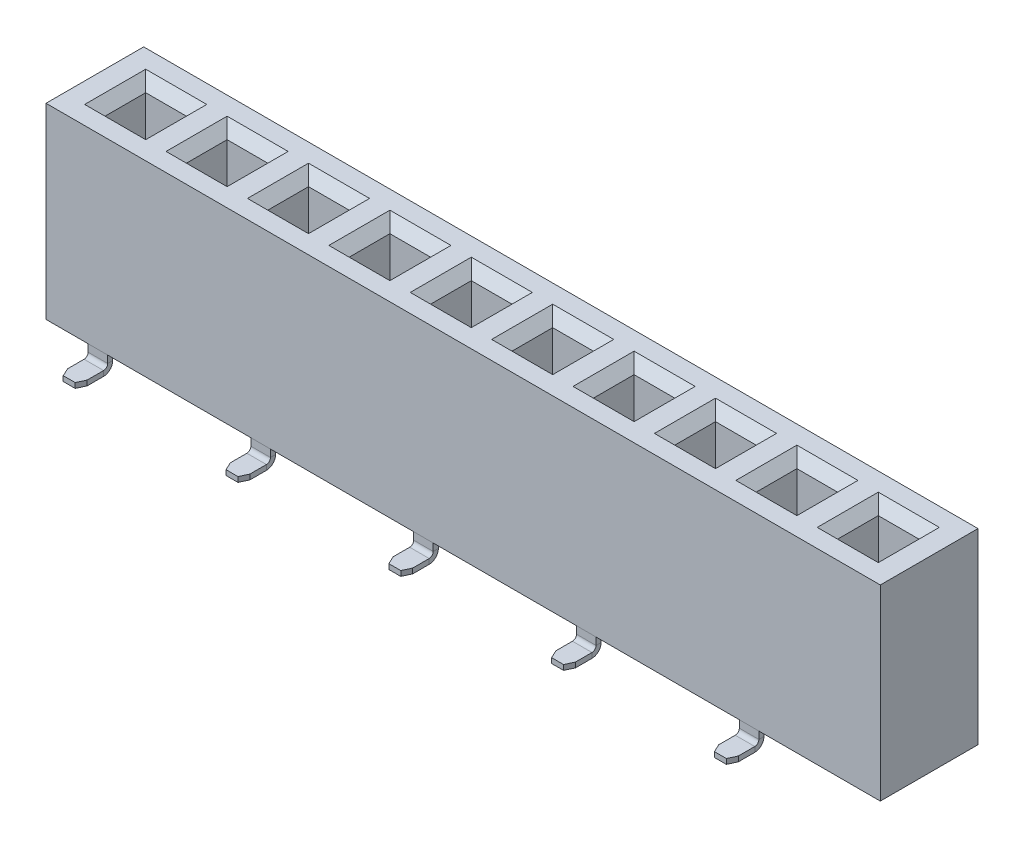
from build123d import *
from OCP.BRepFilletAPI import BRepFilletAPI_MakeChamfer

# Parameters (mm, degrees)
SKETCH1_W                  = 20.5
SKETCH1_H                  = 4.6
BOSS_EXTRUDE1_DEPTH        = 2.4
SKETCH2_W                  = 1
SKETCH2_H                  = 1
CUT_EXTRUDE1_DEPTH         = 2.5
CHAMFER1_SIZE              = 0.25
LPATTERN6_COUNT            = 10
LPATTERN6_PITCH            = 2
CHAMFER1_OF_LPATTERN6_SIZE = 0.25
BASE_FLANGE2_DEPTH         = 0.24
BASE_FLANGE2_DEPTH_BACK    = 0.24
BASE_FLANGE3_DEPTH         = 0.24
BASE_FLANGE3_DEPTH_BACK    = 0.24
CHAMFER3_SIZE              = 0.2
CHAMFER3_SIZE2             = 0.093261532
CHAMFER4_SIZE              = 0.2
CHAMFER4_SIZE2             = 0.093261532
LPATTERN4_COUNT            = 5
LPATTERN4_PITCH            = 4
LPATTERN3_COUNT            = 5
LPATTERN3_PITCH            = 4


# Sheet-metal steps are written as plain solids
with BuildPart() as part:
    # Sketch1 → Boss-Extrude1 (new body)
    with BuildSketch(Plane.XY):
        Rectangle(SKETCH1_W, SKETCH1_H)
    extrude(amount=BOSS_EXTRUDE1_DEPTH)

    # Sketch2 → Cut-Extrude1 (cut)
    with BuildSketch(Plane(origin=(0, 2.3, 0), x_dir=(1, 0, 0), z_dir=(0, 1, 0))):
        with Locations((-9, -1.2)):
            Rectangle(SKETCH2_W, SKETCH2_H)
    cut_extrude1 = extrude(amount=-CUT_EXTRUDE1_DEPTH, mode=Mode.SUBTRACT)

    # Chamfer1
    chamfer1_edges = [part.edges().sort_by_distance(p)[0] for p in [
        (-8.5, 2.3, 1.2),
        (-9, 2.3, 0.7),
        (-9.5, 2.3, 1.2),
        (-9, 2.3, 1.7),
    ]]
    chamfer(chamfer1_edges, length=CHAMFER1_SIZE)

    # LPattern6: Cut-Extrude1 ×10
    with Locations(*[(i * LPATTERN6_PITCH, 0, 0) for i in range(1, LPATTERN6_COUNT)]):
        add(cut_extrude1, mode=Mode.SUBTRACT)

    # Chamfer1 of LPattern6
    chamfer1_of_lpattern6_edges = [part.edges().sort_by_distance(p)[0] for p in [
        (-6.5, 2.3, 1.2),
        (-7, 2.3, 0.7),
        (-7.5, 2.3, 1.2),
        (-7, 2.3, 1.7),
        (-4.5, 2.3, 1.2),
        (-5, 2.3, 0.7),
        (-5.5, 2.3, 1.2),
        (-5, 2.3, 1.7),
        (-2.5, 2.3, 1.2),
        (-3, 2.3, 0.7),
        (-3.5, 2.3, 1.2),
        (-3, 2.3, 1.7),
        (-0.5, 2.3, 1.2),
        (-1, 2.3, 0.7),
        (-1.5, 2.3, 1.2),
        (-1, 2.3, 1.7),
        (1.5, 2.3, 1.2),
        (1, 2.3, 0.7),
        (0.5, 2.3, 1.2),
        (1, 2.3, 1.7),
        (3.5, 2.3, 1.2),
        (3, 2.3, 0.7),
        (2.5, 2.3, 1.2),
        (3, 2.3, 1.7),
        (5.5, 2.3, 1.2),
        (5, 2.3, 0.7),
        (4.5, 2.3, 1.2),
        (5, 2.3, 1.7),
        (7.5, 2.3, 1.2),
        (7, 2.3, 0.7),
        (6.5, 2.3, 1.2),
        (7, 2.3, 1.7),
        (9.5, 2.3, 1.2),
        (9, 2.3, 0.7),
        (8.5, 2.3, 1.2),
        (9, 2.3, 1.7),
    ]]
    chamfer(chamfer1_of_lpattern6_edges, length=CHAMFER1_OF_LPATTERN6_SIZE)


with BuildPart() as body_2:
    # Sketch5 → Base-Flange2 (new, two sides: drawn at the far end of the back side and taken through both)
    with BuildSketch(Plane.ZY.offset(7).offset(-BASE_FLANGE2_DEPTH_BACK)):
        with BuildLine():
            Line((0.15, -2.3), (0.15, -2.505))
            ThreePointArc((0.15, -2.505), (0.084099026, -2.664099026), (-0.075, -2.73))
            Line((-0.075, -2.73), (-0.68, -2.73))
            Line((-0.68, -2.73), (-0.68, -2.605))
            Line((-0.68, -2.605), (-0.075, -2.605))
            ThreePointArc((-0.075, -2.605), (-0.004289322, -2.575710678), (0.025, -2.505))
            Line((0.025, -2.505), (0.025, -2.3))
            Line((0.025, -2.3), (0.15, -2.3))
        make_face()
    extrude(amount=BASE_FLANGE2_DEPTH + BASE_FLANGE2_DEPTH_BACK)

    # Chamfer4: one chamfer whose edges measure the first distance from different faces: ONE call of the kernel's chamfer builder (chamfer() names one face for all edges)
    chamfer4_edges_1 = [body_2.edges().sort_by_distance(p)[0] for p in [
        (-6.76, -2.6675, -0.68),
    ]]
    chamfer4_side_1 = [body_2.faces().sort_by_distance(p)[0] for p in [
        (-6.76, -2.4025, 0.034347727),
    ]]
    chamfer4_edges_2 = [body_2.edges().sort_by_distance(p)[0] for p in [
        (-7.24, -2.6675, -0.68),
    ]]
    chamfer4_side_2 = [body_2.faces().sort_by_distance(p)[0] for p in [
        (-7.24, -2.4025, 0.034347727),
    ]]
    chamfer4 = BRepFilletAPI_MakeChamfer(body_2.part.solid().wrapped)
    for e in chamfer4_edges_1:
        chamfer4.Add(CHAMFER4_SIZE, CHAMFER4_SIZE2, e.wrapped, chamfer4_side_1[0].wrapped)  # the first distance lies on this face
    for e in chamfer4_edges_2:
        chamfer4.Add(CHAMFER4_SIZE, CHAMFER4_SIZE2, e.wrapped, chamfer4_side_2[0].wrapped)  # the first distance lies on this face
    add(Compound.cast(chamfer4.Shape()), mode=Mode.REPLACE)


with BuildPart() as body_3:
    # Sketch22 → Base-Flange3 (new, two sides: drawn at the far end of the back side and taken through both)
    with BuildSketch(Plane.ZY.offset(9).offset(-BASE_FLANGE3_DEPTH_BACK)):
        with BuildLine():
            Line((2.25, -2.3), (2.25, -2.505))
            ThreePointArc((2.25, -2.505), (2.315900974, -2.664099026), (2.475, -2.73))
            Line((2.475, -2.73), (3.08, -2.73))
            Line((3.08, -2.73), (3.08, -2.605))
            Line((3.08, -2.605), (2.475, -2.605))
            ThreePointArc((2.475, -2.605), (2.404289322, -2.575710678), (2.375, -2.505))
            Line((2.375, -2.505), (2.375, -2.3))
            Line((2.375, -2.3), (2.25, -2.3))
        make_face()
    extrude(amount=BASE_FLANGE3_DEPTH + BASE_FLANGE3_DEPTH_BACK)

    # Chamfer3: one chamfer whose edges measure the first distance from different faces: ONE call of the kernel's chamfer builder (chamfer() names one face for all edges)
    chamfer3_edges_1 = [body_3.edges().sort_by_distance(p)[0] for p in [
        (-8.76, -2.6675, 3.08),
    ]]
    chamfer3_side_1 = [body_3.faces().sort_by_distance(p)[0] for p in [
        (-8.76, -2.4025, 2.365652273),
    ]]
    chamfer3_edges_2 = [body_3.edges().sort_by_distance(p)[0] for p in [
        (-9.24, -2.6675, 3.08),
    ]]
    chamfer3_side_2 = [body_3.faces().sort_by_distance(p)[0] for p in [
        (-9.24, -2.4025, 2.365652273),
    ]]
    chamfer3 = BRepFilletAPI_MakeChamfer(body_3.part.solid().wrapped)
    for e in chamfer3_edges_1:
        chamfer3.Add(CHAMFER3_SIZE, CHAMFER3_SIZE2, e.wrapped, chamfer3_side_1[0].wrapped)  # the first distance lies on this face
    for e in chamfer3_edges_2:
        chamfer3.Add(CHAMFER3_SIZE, CHAMFER3_SIZE2, e.wrapped, chamfer3_side_2[0].wrapped)  # the first distance lies on this face
    add(Compound.cast(chamfer3.Shape()), mode=Mode.REPLACE)


with BuildPart() as lpattern4_1:
    # LPattern4: pattern copy
    add(body_2.part.moved(Location(Vector(1, 0, 0) * (1 * LPATTERN4_PITCH))))


with BuildPart() as lpattern4_2:
    # LPattern4: pattern copy
    add(body_2.part.moved(Location(Vector(1, 0, 0) * (2 * LPATTERN4_PITCH))))


with BuildPart() as lpattern4_3:
    # LPattern4: pattern copy
    add(body_2.part.moved(Location(Vector(1, 0, 0) * (3 * LPATTERN4_PITCH))))


with BuildPart() as lpattern4_4:
    # LPattern4: pattern copy
    add(body_2.part.moved(Location(Vector(1, 0, 0) * (4 * LPATTERN4_PITCH))))


with BuildPart() as lpattern3_1:
    # LPattern3: pattern copy
    add(body_3.part.moved(Location(Vector(1, 0, 0) * (1 * LPATTERN3_PITCH))))


with BuildPart() as lpattern3_2:
    # LPattern3: pattern copy
    add(body_3.part.moved(Location(Vector(1, 0, 0) * (2 * LPATTERN3_PITCH))))


with BuildPart() as lpattern3_3:
    # LPattern3: pattern copy
    add(body_3.part.moved(Location(Vector(1, 0, 0) * (3 * LPATTERN3_PITCH))))


with BuildPart() as lpattern3_4:
    # LPattern3: pattern copy
    add(body_3.part.moved(Location(Vector(1, 0, 0) * (4 * LPATTERN3_PITCH))))


solid = Compound([part.part, body_2.part, body_3.part, lpattern4_1.part, lpattern4_2.part, lpattern4_3.part, lpattern4_4.part, lpattern3_1.part, lpattern3_2.part, lpattern3_3.part, lpattern3_4.part])
